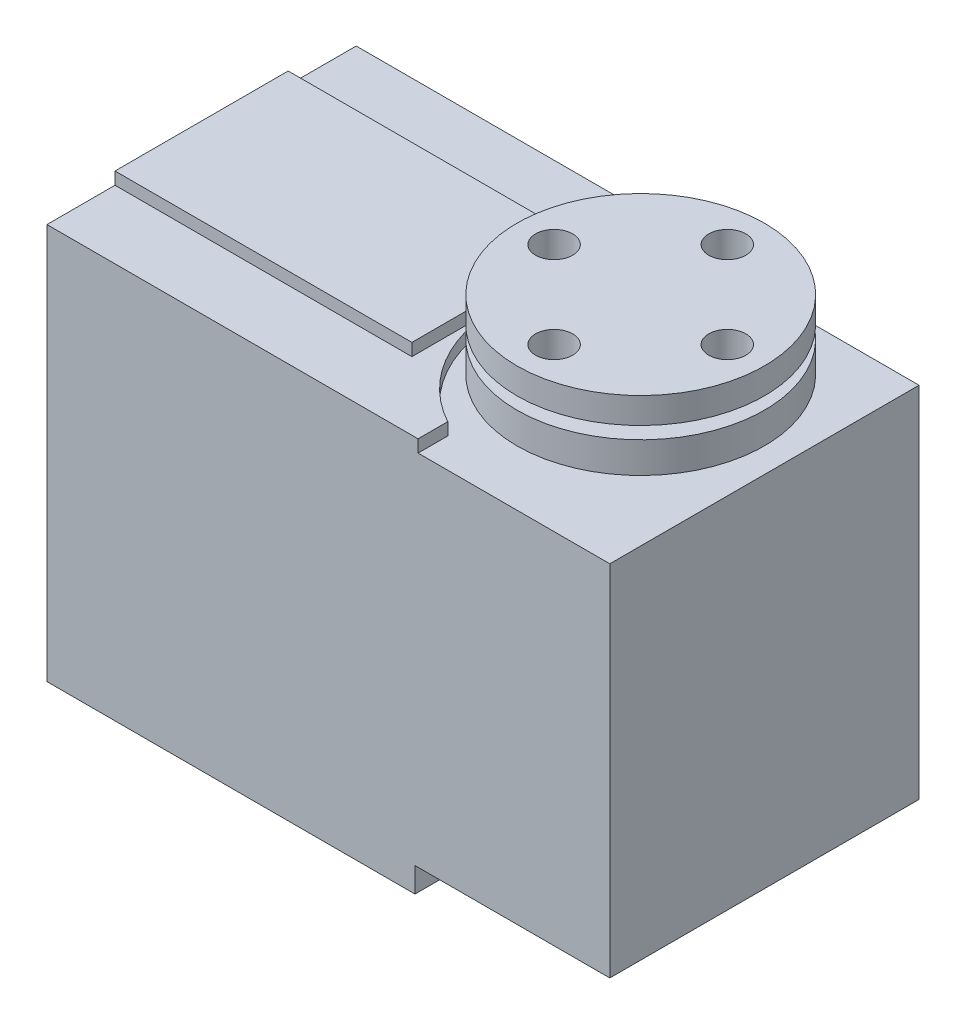
from build123d import *

# Parameters (mm, degrees)
MAIN_BODY_SKETCH_W        = 45.5
MAIN_BODY_SKETCH_H        = 25
MAIN_BODY_EXTRUSION_DEPTH = 29
BOSS_EXTRUDE3_DEPTH       = 1
SKETCH8_W                 = 24
SKETCH8_H                 = 14
BOSS_EXTRUDE8_DEPTH       = 1
SKETCH3_R                 = 2.25
BOSS_EXTRUDE4_DEPTH       = 2
SKETCH6_R                 = 10
BOSS_EXTRUDE7_DEPTH       = 2.5
SKETCH7_R                 = 1.5
CUT_EXTRUDE1_DEPTH        = 2
SKETCH10_R                = 2.25
BOSS_EXTRUDE12_DEPTH      = 1
SKETCH11_R                = 10
BOSS_EXTRUDE13_DEPTH      = 2.1
SKETCH13_R                = 1.5
CUT_EXTRUDE3_DEPTH        = 2.1
BOSS_EXTRUDE9_DEPTH       = 2
SKETCH9_W                 = 5
SKETCH9_H                 = 20
CUT_EXTRUDE2_DEPTH        = 5
SKETCH4_R                 = 3
SKETCH4_R_2               = 1.25
BOSS_EXTRUDE10_DEPTH      = 4.1
SKETCH14_W                = 13.5
SKETCH14_H                = 17.856103011
BOSS_EXTRUDE14_DEPTH      = 2


with BuildPart() as part:
    # Main Body Sketch → Main Body Extrusion (new body)
    with BuildSketch(Plane(origin=(0, 0, 0), x_dir=(1, 0, 0), z_dir=(0, 1, 0))):
        Rectangle(MAIN_BODY_SKETCH_W, MAIN_BODY_SKETCH_H)
    extrude(amount=MAIN_BODY_EXTRUSION_DEPTH)

    # Sketch2 → Boss-Extrude3 (add)
    with BuildSketch(Plane(origin=(0, 29, 0), x_dir=(1, 0, 0), z_dir=(0, 1, 0))):
        with BuildLine():
            Line((-22.75, 12.5), (7.25, 12.5))
            Line((7.25, 12.5), (7.25, 10.099504938))
            ThreePointArc((7.25, 10.099504938), (1.25, 0), (7.25, -10.099504938))
            Line((7.25, -10.099504938), (7.25, -12.5))
            Line((7.25, -12.5), (-22.75, -12.5))
            Line((-22.75, -12.5), (-22.75, 12.5))
        make_face()
    extrude(amount=BOSS_EXTRUDE3_DEPTH)

    # Sketch8 → Boss-Extrude8 (add)
    with BuildSketch(Plane(origin=(0, 30, 0), x_dir=(1, 0, 0), z_dir=(0, 1, 0))):
        with Locations((-10.75, 0)):
            Rectangle(SKETCH8_W, SKETCH8_H)
    extrude(amount=BOSS_EXTRUDE8_DEPTH)

    # Sketch3 → Boss-Extrude4 (add)
    with BuildSketch(Plane(origin=(0, 29, 0), x_dir=(1, 0, 0), z_dir=(0, 1, 0))):
        with Locations((12.75, 0)):
            Circle(SKETCH3_R)
    extrude(amount=BOSS_EXTRUDE4_DEPTH)

    # Sketch6 → Boss-Extrude7 (add)
    with BuildSketch(Plane(origin=(0, 31, 0), x_dir=(1, 0, 0), z_dir=(0, 1, 0))):
        with Locations((12.75, 0)):
            Circle(SKETCH6_R)
    extrude(amount=BOSS_EXTRUDE7_DEPTH)

    # Sketch7 → Cut-Extrude1 (cut)
    with BuildSketch(Plane(origin=(0, 33.5, 0), x_dir=(1, 0, 0), z_dir=(0, 1, 0))):
        with Locations((12.75, 7)):
            Circle(SKETCH7_R)
        with Locations((12.75, -7)):
            Circle(SKETCH7_R)
        with Locations((5.75, 0)):
            Circle(SKETCH7_R)
        with Locations((19.75, 0)):
            Circle(SKETCH7_R)
    extrude(amount=-CUT_EXTRUDE1_DEPTH, mode=Mode.SUBTRACT)

    # Sketch10 → Boss-Extrude12 (add)
    with BuildSketch(Plane(origin=(0, 33.5, 0), x_dir=(1, 0, 0), z_dir=(0, 1, 0))):
        with Locations((12.75, 0)):
            Circle(SKETCH10_R)
    extrude(amount=BOSS_EXTRUDE12_DEPTH)

    # Sketch11 → Boss-Extrude13 (add)
    with BuildSketch(Plane(origin=(0, 34.5, 0), x_dir=(1, 0, 0), z_dir=(0, 1, 0))):
        with Locations((12.75, 0)):
            Circle(SKETCH11_R)
    extrude(amount=BOSS_EXTRUDE13_DEPTH)

    # Sketch13 → Cut-Extrude3 (cut)
    with BuildSketch(Plane(origin=(0, 36.6, 0), x_dir=(1, 0, 0), z_dir=(0, 1, 0))):
        with Locations((12.75, 7)):
            Circle(SKETCH13_R)
        with Locations((5.75, 0)):
            Circle(SKETCH13_R)
        with Locations((12.75, -7)):
            Circle(SKETCH13_R)
        with Locations((19.75, 0)):
            Circle(SKETCH13_R)
    extrude(amount=-CUT_EXTRUDE3_DEPTH, mode=Mode.SUBTRACT)

    # Sketch5 → Boss-Extrude9 (add)
    with BuildSketch(Plane.XZ):
        Polygon((-22.75, 12.5), (-22.75, -12.5), (7, -12.5), (7, -10), (3.5, -6.5), (1, -6.5), (1, -10), (-4, -10), (-4, 10), (1, 10), (1, 6.5), (3.5, 6.5), (7, 10), (7, 12.5), align=None)
    extrude(amount=BOSS_EXTRUDE9_DEPTH)

    # Sketch9 → Cut-Extrude2 (cut)
    with BuildSketch(Plane.XZ):
        with Locations((-1.5, 0)):
            Rectangle(SKETCH9_W, SKETCH9_H)
    extrude(amount=-CUT_EXTRUDE2_DEPTH, mode=Mode.SUBTRACT)

    # Sketch4 → Boss-Extrude10 (add)
    with BuildSketch(Plane.XZ):
        with Locations((12.5, 0)):
            Circle(SKETCH4_R)
        with Locations((12.5, 0)):
            Circle(SKETCH4_R_2, mode=Mode.SUBTRACT)
    extrude(amount=BOSS_EXTRUDE10_DEPTH)

    # Sketch14 → Boss-Extrude14 (add)
    with BuildSketch(Plane.XZ.offset(2)):
        with Locations((-10.75, -0.020714737)):
            Rectangle(SKETCH14_W, SKETCH14_H)
    extrude(amount=BOSS_EXTRUDE14_DEPTH)


solid = part.part
